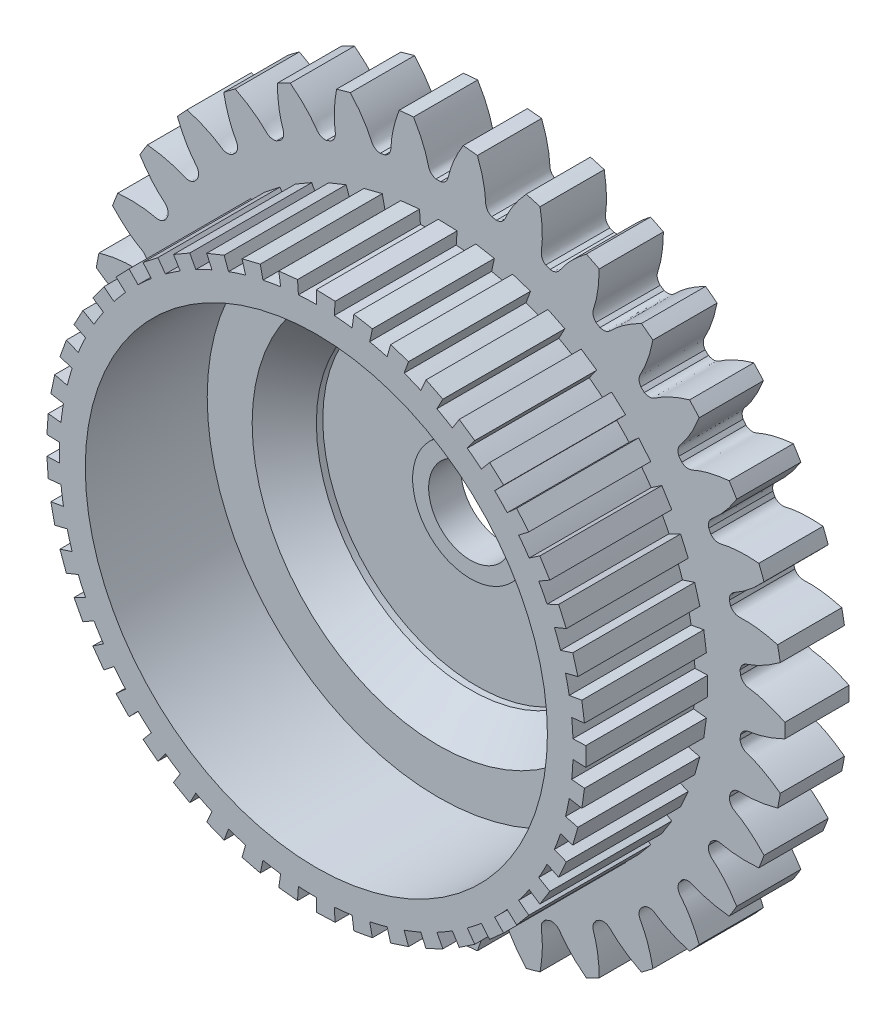
from build123d import *

# Parameters (mm, degrees)
SKETCH_1_R               = 27
EXTRUDE_1_DEPTH          = 5
CUT_EXTRUDE_1_DEPTH      = 39.509739028
PATTERN_CIRCULAR_1_COUNT = 34
SKETCH_4_R               = 12
SKETCH_4_R_2             = 4.5
SKETCH_4_R_3             = 3.25
CUT_EXTRUDE_2_DEPTH      = 3
CHAMFER_1_SIZE           = 2.5
SKETCH_6_R               = 3.25
CUT_EXTRUDE_3_DEPTH      = 39.252654908
SKETCH_7_R               = 18
EXTRUDE_2_DEPTH          = 9.5
SKETCH_8_R               = 4.5
CUT_EXTRUDE_4_DEPTH      = 2.5


with BuildPart() as part:
    # 草图1 → 凸台-拉伸1 (new body)
    with BuildSketch(Plane.XY):
        Circle(SKETCH_1_R)
    extrude(amount=EXTRUDE_1_DEPTH)

    # 草图2 → 切除-拉伸1 (cut, through all)
    with BuildSketch(Plane.XY):
        with BuildLine():
            ThreePointArc((0.183171175, 23.624289901), (0, 23.625), (-0.183171175, 23.624289901))
            add(Edge.make_bspline(
                [(-0.183171175, 23.624289901), (-0.716587806, 23.775112896), (-0.763410395, 24.188787315), (-0.879946356, 24.623629896), (-0.912930358, 24.738245821), (-0.951084244, 24.861314333), (-0.99469329, 24.992699977), (-1.044123655, 25.132221413), (-1.099711127, 25.279697341), (-1.161793992, 25.434932943), (-1.230702926, 25.597724076), (-1.306763614, 25.76785621), (-1.390295632, 25.945104927), (-1.481612426, 26.129235971), (-1.581020975, 26.320005435), (-1.688821555, 26.51715992), (-1.805307471, 26.720436707), (-1.930764813, 26.929563939), (-2.065472203, 27.144260803), (-2.209700557, 27.364237722), (-2.36371284, 27.589196551), (-2.527763841, 27.818830783), (-2.702099938, 28.052825758), (-2.886958877, 28.290858874), (-3.082569553, 28.532599812), (-3.289151799, 28.777710761), (-3.506916179, 29.025846649), (-3.73606378, 29.276655378), (-3.97678604, 29.52977807), (-4.229264468, 29.784849315), (-4.586391615, 30.131497572), (-4.865591808, 30.386500811), (-5.057363345, 30.554916542)],
                knots=[0, 0, 0, 0, 0.13072362, 0.143503881, 0.157401081, 0.17241522, 0.188546299, 0.205794316, 0.224159273, 0.243641169, 0.264240005, 0.285955779, 0.308788493, 0.332738146, 0.357804738, 0.383988269, 0.411288739, 0.439706149, 0.469240498, 0.499891786, 0.531660014, 0.56454518, 0.598547286, 0.633666331, 0.669902315, 0.707255238, 0.745725101, 0.785311903, 0.826015644, 0.867836324, 0.910773943, 1, 1, 1, 1], degree=3))
            ThreePointArc((-5.057363345, 30.554916542), (0, 30.970628811), (5.057363345, 30.554916542))
            add(Edge.make_bspline(
                [(0.183171175, 23.624289901), (0.716587806, 23.775112896), (0.763410395, 24.188787315), (0.879946356, 24.623629896), (0.912930358, 24.738245821), (0.951084244, 24.861314333), (0.99469329, 24.992699977), (1.044123655, 25.132221413), (1.099711127, 25.279697341), (1.161793992, 25.434932943), (1.230702926, 25.597724076), (1.306763614, 25.76785621), (1.390295632, 25.945104927), (1.481612426, 26.129235971), (1.581020975, 26.320005435), (1.688821555, 26.51715992), (1.805307471, 26.720436707), (1.930764813, 26.929563939), (2.065472203, 27.144260803), (2.209700557, 27.364237722), (2.36371284, 27.589196551), (2.527763841, 27.818830783), (2.702099938, 28.052825758), (2.886958877, 28.290858874), (3.082569553, 28.532599812), (3.289151799, 28.777710761), (3.506916179, 29.025846649), (3.73606378, 29.276655378), (3.97678604, 29.52977807), (4.229264468, 29.784849315), (4.586391615, 30.131497572), (4.865591808, 30.386500811), (5.057363345, 30.554916542)],
                knots=[0, 0, 0, 0, 0.13072362, 0.143503881, 0.157401081, 0.17241522, 0.188546299, 0.205794316, 0.224159273, 0.243641169, 0.264240005, 0.285955779, 0.308788493, 0.332738146, 0.357804738, 0.383988269, 0.411288739, 0.439706149, 0.469240498, 0.499891786, 0.531660014, 0.56454518, 0.598547286, 0.633666331, 0.669902315, 0.707255238, 0.745725101, 0.785311903, 0.826015644, 0.867836324, 0.910773943, 1, 1, 1, 1], degree=3))
        make_face()
    cut_extrude_1 = extrude(amount=CUT_EXTRUDE_1_DEPTH, mode=Mode.SUBTRACT)

    # 阵列(圆周)1: 切除-拉伸1 ×34 about axis
    pattern_circular_1_axis = Axis((0, 0, -1.5), (0, 0, 1))
    for i in range(1, PATTERN_CIRCULAR_1_COUNT):
        add(cut_extrude_1.rotate(pattern_circular_1_axis, i * 360 / PATTERN_CIRCULAR_1_COUNT), mode=Mode.SUBTRACT)

    # 草图4 → 切除-拉伸2 (cut)
    # profile 1 of 2: a face of its own
    with BuildSketch(Plane.XY.offset(5)):
        Circle(SKETCH_4_R)
        Circle(SKETCH_4_R_2, mode=Mode.SUBTRACT)
    # profile 2 of 2: a face of its own
    with BuildSketch(Plane.XY.offset(5)):
        Circle(SKETCH_4_R_3)
    extrude(amount=-CUT_EXTRUDE_2_DEPTH, mode=Mode.SUBTRACT)

    # 倒角1
    chamfer_1_edges = [part.edges().sort_by_distance(p)[0] for p in [
        (-12, 0, 5),
    ]]
    chamfer(chamfer_1_edges, length=CHAMFER_1_SIZE)

    # 草图6 → 切除-拉伸3 (cut, through all)
    with BuildSketch(Plane.XY.offset(2)):
        Circle(SKETCH_6_R)
    extrude(amount=-CUT_EXTRUDE_3_DEPTH, mode=Mode.SUBTRACT)

    # 草图7 → 凸台-拉伸2 (add)
    with BuildSketch(Plane.XY.offset(5)):
        with BuildLine():
            ThreePointArc((2.783462019, 19.805361375), (2.090569265, 19.890437907), (1.395129475, 19.951281005))
            Line((1.395129475, 19.951281005), (1.464885949, 20.948845055))
            Line((1.464885949, 20.948845055), (0, 21))
            Line((0, 21), (0, 20))
            ThreePointArc((0, 20), (-0.697989934, 19.98781654), (-1.395129475, 19.951281005))
            Line((-1.395129475, 19.951281005), (-1.464885949, 20.948845055))
            Line((-1.464885949, 20.948845055), (-2.92263512, 20.795629444))
            Line((-2.92263512, 20.795629444), (-2.783462019, 19.805361375))
            ThreePointArc((-2.783462019, 19.805361375), (-3.472963553, 19.69615506), (-4.158233816, 19.562952015))
            Line((-4.158233816, 19.562952015), (-4.366145507, 20.541099615))
            Line((-4.366145507, 20.541099615), (-5.788384472, 20.186495615))
            Line((-5.788384472, 20.186495615), (-5.512747116, 19.225233919))
            ThreePointArc((-5.512747116, 19.225233919), (-6.180339887, 19.021130326), (-6.840402867, 18.793852416))
            Line((-6.840402867, 18.793852416), (-7.18242301, 19.733545037))
            Line((-7.18242301, 19.733545037), (-8.541469505, 19.18445461))
            Line((-8.541469505, 19.18445461), (-8.134732862, 18.270909153))
            ThreePointArc((-8.134732862, 18.270909153), (-8.767422936, 17.975880926), (-9.389431256, 17.658951857))
            Line((-9.389431256, 17.658951857), (-9.858902819, 18.54189945))
            Line((-9.858902819, 18.54189945), (-11.128304549, 17.809010019))
            Line((-11.128304549, 17.809010019), (-10.598385285, 16.960961923))
            ThreePointArc((-10.598385285, 16.960961923), (-11.183858069, 16.580751451), (-11.755705046, 16.180339887))
            Line((-11.755705046, 16.180339887), (-12.343490298, 16.989356882))
            Line((-12.343490298, 16.989356882), (-13.498539803, 16.086933305))
            Line((-13.498539803, 16.086933305), (-12.855752194, 15.320888862))
            ThreePointArc((-12.855752194, 15.320888862), (-13.382612127, 14.86289651), (-13.893167409, 14.386796007))
            Line((-13.893167409, 14.386796007), (-14.58782578, 15.106135807))
            Line((-14.58782578, 15.106135807), (-15.606041335, 14.051742734))
            Line((-15.606041335, 14.051742734), (-14.86289651, 13.382612127))
            ThreePointArc((-14.86289651, 13.382612127), (-15.320888862, 12.855752194), (-15.760215072, 12.313229507))
            Line((-15.760215072, 12.313229507), (-16.548225826, 12.928890982))
            Line((-16.548225826, 12.928890982), (-17.409789024, 11.743050973))
            Line((-17.409789024, 11.743050973), (-16.580751451, 11.183858069))
            ThreePointArc((-16.580751451, 11.183858069), (-16.960961923, 10.598385285), (-17.320508076, 10))
            Line((-17.320508076, 10), (-18.186533479, 10.5))
            Line((-18.186533479, 10.5), (-18.874674972, 9.205794083))
            Line((-18.874674972, 9.205794083), (-17.975880926, 8.767422936))
            ThreePointArc((-17.975880926, 8.767422936), (-18.270909153, 8.134732862), (-18.543677091, 7.492131868))
            Line((-18.543677091, 7.492131868), (-19.470860946, 7.866738462))
            Line((-19.470860946, 7.866738462), (-19.972186842, 6.489356882))
            Line((-19.972186842, 6.489356882), (-19.021130326, 6.180339887))
            ThreePointArc((-19.021130326, 6.180339887), (-19.225233919, 5.512747116), (-19.405914526, 4.838437912))
            Line((-19.405914526, 4.838437912), (-20.376210252, 5.080359808))
            Line((-20.376210252, 5.080359808), (-20.680962813, 3.646611731))
            Line((-20.680962813, 3.646611731), (-19.69615506, 3.472963553))
            ThreePointArc((-19.69615506, 3.472963553), (-19.805361375, 2.783462019), (-19.890437907, 2.090569265))
            Line((-19.890437907, 2.090569265), (-20.884959803, 2.195097729))
            Line((-20.884959803, 2.195097729), (-20.987207367, 0.732889431))
            Line((-20.987207367, 0.732889431), (-19.98781654, 0.697989934))
            ThreePointArc((-19.98781654, 0.697989934), (-20, 0), (-19.98781654, -0.697989934))
            Line((-19.98781654, -0.697989934), (-20.987207367, -0.732889431))
            Line((-20.987207367, -0.732889431), (-20.884959803, -2.195097729))
            Line((-20.884959803, -2.195097729), (-19.890437907, -2.090569265))
            ThreePointArc((-19.890437907, -2.090569265), (-19.805361375, -2.783462019), (-19.69615506, -3.472963553))
            Line((-19.69615506, -3.472963553), (-20.680962813, -3.646611731))
            Line((-20.680962813, -3.646611731), (-20.376210252, -5.080359808))
            Line((-20.376210252, -5.080359808), (-19.405914526, -4.838437912))
            ThreePointArc((-19.405914526, -4.838437912), (-19.225233919, -5.512747116), (-19.021130326, -6.180339887))
            Line((-19.021130326, -6.180339887), (-19.972186842, -6.489356882))
            Line((-19.972186842, -6.489356882), (-19.470860946, -7.866738462))
            Line((-19.470860946, -7.866738462), (-18.543677091, -7.492131868))
            ThreePointArc((-18.543677091, -7.492131868), (-18.270909153, -8.134732862), (-17.975880926, -8.767422936))
            Line((-17.975880926, -8.767422936), (-18.874674972, -9.205794083))
            Line((-18.874674972, -9.205794083), (-18.186533479, -10.5))
            Line((-18.186533479, -10.5), (-17.320508076, -10))
            ThreePointArc((-17.320508076, -10), (-16.960961923, -10.598385285), (-16.580751451, -11.183858069))
            Line((-16.580751451, -11.183858069), (-17.409789024, -11.743050973))
            Line((-17.409789024, -11.743050973), (-16.548225826, -12.928890982))
            Line((-16.548225826, -12.928890982), (-15.760215072, -12.313229507))
            ThreePointArc((-15.760215072, -12.313229507), (-15.320888862, -12.855752194), (-14.86289651, -13.382612127))
            Line((-14.86289651, -13.382612127), (-15.606041335, -14.051742734))
            Line((-15.606041335, -14.051742734), (-14.58782578, -15.106135807))
            Line((-14.58782578, -15.106135807), (-13.893167409, -14.386796007))
            ThreePointArc((-13.893167409, -14.386796007), (-13.382612127, -14.86289651), (-12.855752194, -15.320888862))
            Line((-12.855752194, -15.320888862), (-13.498539803, -16.086933305))
            Line((-13.498539803, -16.086933305), (-12.343490298, -16.989356882))
            Line((-12.343490298, -16.989356882), (-11.755705046, -16.180339887))
            ThreePointArc((-11.755705046, -16.180339887), (-11.183858069, -16.580751451), (-10.598385285, -16.960961923))
            Line((-10.598385285, -16.960961923), (-11.128304549, -17.809010019))
            Line((-11.128304549, -17.809010019), (-9.858902819, -18.54189945))
            Line((-9.858902819, -18.54189945), (-9.389431256, -17.658951857))
            ThreePointArc((-9.389431256, -17.658951857), (-8.767422936, -17.975880926), (-8.134732862, -18.270909153))
            Line((-8.134732862, -18.270909153), (-8.541469505, -19.18445461))
            Line((-8.541469505, -19.18445461), (-7.18242301, -19.733545037))
            Line((-7.18242301, -19.733545037), (-6.840402867, -18.793852416))
            ThreePointArc((-6.840402867, -18.793852416), (-6.180339887, -19.021130326), (-5.512747116, -19.225233919))
            Line((-5.512747116, -19.225233919), (-5.788384472, -20.186495615))
            Line((-5.788384472, -20.186495615), (-4.366145507, -20.541099615))
            Line((-4.366145507, -20.541099615), (-4.158233816, -19.562952015))
            ThreePointArc((-4.158233816, -19.562952015), (-3.472963553, -19.69615506), (-2.783462019, -19.805361375))
            Line((-2.783462019, -19.805361375), (-2.92263512, -20.795629444))
            Line((-2.92263512, -20.795629444), (-1.464885949, -20.948845055))
            Line((-1.464885949, -20.948845055), (-1.395129475, -19.951281005))
            ThreePointArc((-1.395129475, -19.951281005), (-0.697989934, -19.98781654), (0, -20))
            Line((0, -20), (0, -21))
            Line((0, -21), (1.464885949, -20.948845055))
            Line((1.464885949, -20.948845055), (1.395129475, -19.951281005))
            ThreePointArc((1.395129475, -19.951281005), (2.090569265, -19.890437907), (2.783462019, -19.805361375))
            Line((2.783462019, -19.805361375), (2.92263512, -20.795629444))
            Line((2.92263512, -20.795629444), (4.366145507, -20.541099615))
            Line((4.366145507, -20.541099615), (4.158233816, -19.562952015))
            ThreePointArc((4.158233816, -19.562952015), (4.838437912, -19.405914526), (5.512747116, -19.225233919))
            Line((5.512747116, -19.225233919), (5.788384472, -20.186495615))
            Line((5.788384472, -20.186495615), (7.18242301, -19.733545037))
            Line((7.18242301, -19.733545037), (6.840402867, -18.793852416))
            ThreePointArc((6.840402867, -18.793852416), (7.492131868, -18.543677091), (8.134732862, -18.270909153))
            Line((8.134732862, -18.270909153), (8.541469505, -19.18445461))
            Line((8.541469505, -19.18445461), (9.858902819, -18.54189945))
            Line((9.858902819, -18.54189945), (9.389431256, -17.658951857))
            ThreePointArc((9.389431256, -17.658951857), (10, -17.320508076), (10.598385285, -16.960961923))
            Line((10.598385285, -16.960961923), (11.128304549, -17.809010019))
            Line((11.128304549, -17.809010019), (12.343490298, -16.989356882))
            Line((12.343490298, -16.989356882), (11.755705046, -16.180339887))
            ThreePointArc((11.755705046, -16.180339887), (12.313229507, -15.760215072), (12.855752194, -15.320888862))
            Line((12.855752194, -15.320888862), (13.498539803, -16.086933305))
            Line((13.498539803, -16.086933305), (14.58782578, -15.106135807))
            Line((14.58782578, -15.106135807), (13.893167409, -14.386796007))
            ThreePointArc((13.893167409, -14.386796007), (14.386796007, -13.893167409), (14.86289651, -13.382612127))
            Line((14.86289651, -13.382612127), (15.606041335, -14.051742734))
            Line((15.606041335, -14.051742734), (16.548225826, -12.928890982))
            Line((16.548225826, -12.928890982), (15.760215072, -12.313229507))
            ThreePointArc((15.760215072, -12.313229507), (16.180339887, -11.755705046), (16.580751451, -11.183858069))
            Line((16.580751451, -11.183858069), (17.409789024, -11.743050973))
            Line((17.409789024, -11.743050973), (18.186533479, -10.5))
            Line((18.186533479, -10.5), (17.320508076, -10))
            ThreePointArc((17.320508076, -10), (17.658951857, -9.389431256), (17.975880926, -8.767422936))
            Line((17.975880926, -8.767422936), (18.874674972, -9.205794083))
            Line((18.874674972, -9.205794083), (19.470860946, -7.866738462))
            Line((19.470860946, -7.866738462), (18.543677091, -7.492131868))
            ThreePointArc((18.543677091, -7.492131868), (18.793852416, -6.840402867), (19.021130326, -6.180339887))
            Line((19.021130326, -6.180339887), (19.972186842, -6.489356882))
            Line((19.972186842, -6.489356882), (20.376210252, -5.080359808))
            Line((20.376210252, -5.080359808), (19.405914526, -4.838437912))
            ThreePointArc((19.405914526, -4.838437912), (19.562952015, -4.158233816), (19.69615506, -3.472963553))
            Line((19.69615506, -3.472963553), (20.680962813, -3.646611731))
            Line((20.680962813, -3.646611731), (20.884959803, -2.195097729))
            Line((20.884959803, -2.195097729), (19.890437907, -2.090569265))
            ThreePointArc((19.890437907, -2.090569265), (19.951281005, -1.395129475), (19.98781654, -0.697989934))
            Line((19.98781654, -0.697989934), (20.987207367, -0.732889431))
            Line((20.987207367, -0.732889431), (20.987207367, 0.732889431))
            Line((20.987207367, 0.732889431), (19.98781654, 0.697989934))
            ThreePointArc((19.98781654, 0.697989934), (19.951281005, 1.395129475), (19.890437907, 2.090569265))
            Line((19.890437907, 2.090569265), (20.884959803, 2.195097729))
            Line((20.884959803, 2.195097729), (20.680962813, 3.646611731))
            Line((20.680962813, 3.646611731), (19.69615506, 3.472963553))
            ThreePointArc((19.69615506, 3.472963553), (19.562952015, 4.158233816), (19.405914526, 4.838437912))
            Line((19.405914526, 4.838437912), (20.376210252, 5.080359808))
            Line((20.376210252, 5.080359808), (19.972186842, 6.489356882))
            Line((19.972186842, 6.489356882), (19.021130326, 6.180339887))
            ThreePointArc((19.021130326, 6.180339887), (18.793852416, 6.840402867), (18.543677091, 7.492131868))
            Line((18.543677091, 7.492131868), (19.470860946, 7.866738462))
            Line((19.470860946, 7.866738462), (18.874674972, 9.205794083))
            Line((18.874674972, 9.205794083), (17.975880926, 8.767422936))
            ThreePointArc((17.975880926, 8.767422936), (17.658951857, 9.389431256), (17.320508076, 10))
            Line((17.320508076, 10), (18.186533479, 10.5))
            Line((18.186533479, 10.5), (17.409789024, 11.743050973))
            Line((17.409789024, 11.743050973), (16.580751451, 11.183858069))
            ThreePointArc((16.580751451, 11.183858069), (16.180339887, 11.755705046), (15.760215072, 12.313229507))
            Line((15.760215072, 12.313229507), (16.548225826, 12.928890982))
            Line((16.548225826, 12.928890982), (15.606041335, 14.051742734))
            Line((15.606041335, 14.051742734), (14.86289651, 13.382612127))
            ThreePointArc((14.86289651, 13.382612127), (14.386796007, 13.893167409), (13.893167409, 14.386796007))
            Line((13.893167409, 14.386796007), (14.58782578, 15.106135807))
            Line((14.58782578, 15.106135807), (13.498539803, 16.086933305))
            Line((13.498539803, 16.086933305), (12.855752194, 15.320888862))
            ThreePointArc((12.855752194, 15.320888862), (12.313229507, 15.760215072), (11.755705046, 16.180339887))
            Line((11.755705046, 16.180339887), (12.343490298, 16.989356882))
            Line((12.343490298, 16.989356882), (11.128304549, 17.809010019))
            Line((11.128304549, 17.809010019), (10.598385285, 16.960961923))
            ThreePointArc((10.598385285, 16.960961923), (10, 17.320508076), (9.389431256, 17.658951857))
            Line((9.389431256, 17.658951857), (9.858902819, 18.54189945))
            Line((9.858902819, 18.54189945), (8.541469505, 19.18445461))
            Line((8.541469505, 19.18445461), (8.134732862, 18.270909153))
            ThreePointArc((8.134732862, 18.270909153), (7.492131868, 18.543677091), (6.840402867, 18.793852416))
            Line((6.840402867, 18.793852416), (7.18242301, 19.733545037))
            Line((7.18242301, 19.733545037), (5.788384472, 20.186495615))
            Line((5.788384472, 20.186495615), (5.512747116, 19.225233919))
            ThreePointArc((5.512747116, 19.225233919), (4.838437912, 19.405914526), (4.158233816, 19.562952015))
            Line((4.158233816, 19.562952015), (4.366145507, 20.541099615))
            Line((4.366145507, 20.541099615), (2.92263512, 20.795629444))
            Line((2.92263512, 20.795629444), (2.783462019, 19.805361375))
        make_face()
        Circle(SKETCH_7_R, mode=Mode.SUBTRACT)
    extrude(amount=EXTRUDE_2_DEPTH)

    # 草图8 → 切除-拉伸4 (cut)
    with BuildSketch(Plane.XY.offset(5)):
        Circle(SKETCH_8_R)
    extrude(amount=-CUT_EXTRUDE_4_DEPTH, mode=Mode.SUBTRACT)


solid = part.part
